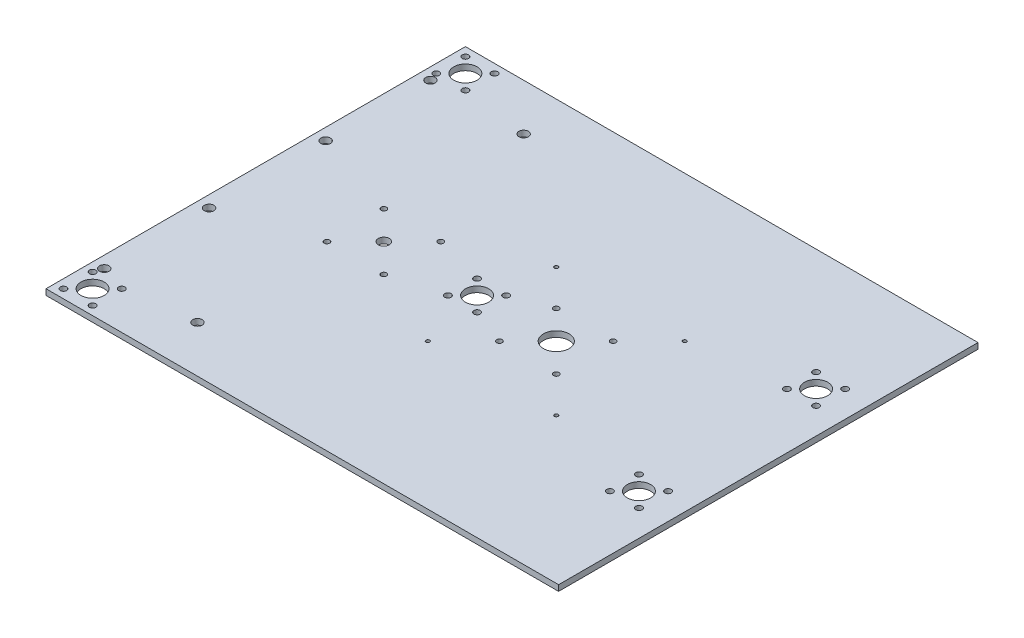
from build123d import *

# Parameters (mm, degrees)
SKETCH1_W               = 279.4
SKETCH1_H               = 228.6
BOSS_EXTRUDE1_DEPTH     = 3.175
SKETCH3_R               = 2.600000007
CUT_EXTRUDE1_DEPTH      = 181.528835993
SKETCH5_R               = 1.5
SKETCH5_R_2             = 3.007999953
CUT_EXTRUDE2_DEPTH      = 181.528835993
SKETCH7_R               = 0.999998
CUT_EXTRUDE3_DEPTH      = 181.528835993
CUT_EXTRUDE5_DEPTH      = 181.528835993
CUT_EXTRUDE5_DEPTH_BACK = 181.528835993
SKETCH9_R               = 1.726999975
SKETCH9_R_2             = 6.35
CUT_EXTRUDE6_DEPTH      = 181.528835993
CUT_EXTRUDE6_DEPTH_BACK = 181.528835993
SKETCH11_R              = 1.5
SKETCH11_R_2            = 6.985


with BuildPart() as part:
    # Sketch1 → Boss-Extrude1 (new body)
    with BuildSketch(Plane(origin=(0, 0, 0), x_dir=(1, 0, 0), z_dir=(0, 1, 0))):
        Rectangle(SKETCH1_W, SKETCH1_H)
    extrude(amount=BOSS_EXTRUDE1_DEPTH)

    # Sketch3 → Cut-Extrude1 (cut, through all)
    with BuildSketch(Plane(origin=(0, 3.175, 0), x_dir=(1, 0, 0), z_dir=(0, 1, 0))):
        with Locations((-133.35, -31.75)):
            Circle(SKETCH3_R)
        with Locations((-82.55, -88.9)):
            Circle(SKETCH3_R)
        with Locations((-133.35, -88.9)):
            Circle(SKETCH3_R)
    cut_extrude1 = extrude(amount=-CUT_EXTRUDE1_DEPTH, mode=Mode.SUBTRACT)

    # Mirror1: Cut-Extrude1 across plane
    add(cut_extrude1.mirror(Plane.XY), mode=Mode.SUBTRACT)

    # Sketch5 → Cut-Extrude2 (cut, through all)
    with BuildSketch(Plane(origin=(0, 3.175, 0), x_dir=(1, 0, 0), z_dir=(0, 1, 0))):
        with Locations((-54.374, 15.5)):
            Circle(SKETCH5_R)
        with Locations((-54.374, -15.5)):
            Circle(SKETCH5_R)
        with Locations((-85.374, 15.5)):
            Circle(SKETCH5_R)
        with Locations((-85.374, -15.5)):
            Circle(SKETCH5_R)
        with Locations((-69.874, 0)):
            Circle(SKETCH5_R_2)
    extrude(amount=-CUT_EXTRUDE2_DEPTH, mode=Mode.SUBTRACT)

    # Sketch7 → Cut-Extrude3 (cut, through all)
    with BuildSketch(Plane(origin=(0, 3.175, 0), x_dir=(1, 0, 0), z_dir=(0, 1, 0))):
        with Locations((59.131787507, -35.001787507)):
            Circle(SKETCH7_R)
        with Locations((-10.871787507, -35.001787507)):
            Circle(SKETCH7_R)
        with Locations((-10.871787507, 35.001787507)):
            Circle(SKETCH7_R)
        with Locations((59.131787507, 35.001787507)):
            Circle(SKETCH7_R)
    extrude(amount=-CUT_EXTRUDE3_DEPTH, mode=Mode.SUBTRACT)

    # Sketch9 → Cut-Extrude5 (cut, two sides: drawn at the far end of the back side and taken through both)
    with BuildSketch(Plane(origin=(0, 3.175, 0), x_dir=(1, 0, 0), z_dir=(0, 1, 0)).offset(-CUT_EXTRUDE5_DEPTH_BACK)):
        with Locations((-119.0625, -109.5375)):
            Circle(SKETCH9_R)
        with Locations((-119.0625, -93.6625)):
            Circle(SKETCH9_R)
        with Locations((-134.9375, -93.6625)):
            Circle(SKETCH9_R)
        with Locations((-134.9375, -109.5375)):
            Circle(SKETCH9_R)
        with Locations((-127, -101.6)):
            Circle(SKETCH9_R_2)
        with Locations((125.4125, -56.1975)):
            Circle(SKETCH9_R)
        with Locations((125.4125, -40.3225)):
            Circle(SKETCH9_R)
        with Locations((117.475, -48.26)):
            Circle(SKETCH9_R_2)
        with Locations((109.5375, -40.3225)):
            Circle(SKETCH9_R)
        with Locations((109.5375, -56.1975)):
            Circle(SKETCH9_R)
        with Locations((-11.1125, 7.9375)):
            Circle(SKETCH9_R)
        with Locations((-11.1125, -7.9375)):
            Circle(SKETCH9_R)
        with Locations((-19.05, 0)):
            Circle(SKETCH9_R_2)
        with Locations((-26.9875, -7.9375)):
            Circle(SKETCH9_R)
        with Locations((-26.9875, 7.9375)):
            Circle(SKETCH9_R)
        with Locations((109.5375, 56.1975)):
            Circle(SKETCH9_R)
        with Locations((109.5375, 40.3225)):
            Circle(SKETCH9_R)
        with Locations((125.4125, 56.1975)):
            Circle(SKETCH9_R)
        with Locations((117.475, 48.26)):
            Circle(SKETCH9_R_2)
        with Locations((125.4125, 40.3225)):
            Circle(SKETCH9_R)
        with Locations((-119.0625, 93.6625)):
            Circle(SKETCH9_R)
        with Locations((-119.0625, 109.5375)):
            Circle(SKETCH9_R)
        with Locations((-134.9375, 109.5375)):
            Circle(SKETCH9_R)
        with Locations((-134.9375, 93.6625)):
            Circle(SKETCH9_R)
        with Locations((-127, 101.6)):
            Circle(SKETCH9_R_2)
    extrude(amount=CUT_EXTRUDE5_DEPTH + CUT_EXTRUDE5_DEPTH_BACK, mode=Mode.SUBTRACT)

    # Sketch11 → Cut-Extrude6 (cut, two sides: drawn at the far end of the back side and taken through both)
    with BuildSketch(Plane(origin=(0, 3.175, 0), x_dir=(1, 0, 0), z_dir=(0, 1, 0)).offset(-CUT_EXTRUDE6_DEPTH_BACK)):
        with Locations((39.63, 15.5)):
            Circle(SKETCH11_R)
        with Locations((39.63, -15.5)):
            Circle(SKETCH11_R)
        with Locations((8.63, -15.5)):
            Circle(SKETCH11_R)
        with Locations((8.63, 15.5)):
            Circle(SKETCH11_R)
        with Locations((24.13, 0)):
            Circle(SKETCH11_R_2)
    extrude(amount=CUT_EXTRUDE6_DEPTH + CUT_EXTRUDE6_DEPTH_BACK, mode=Mode.SUBTRACT)


solid = part.part
